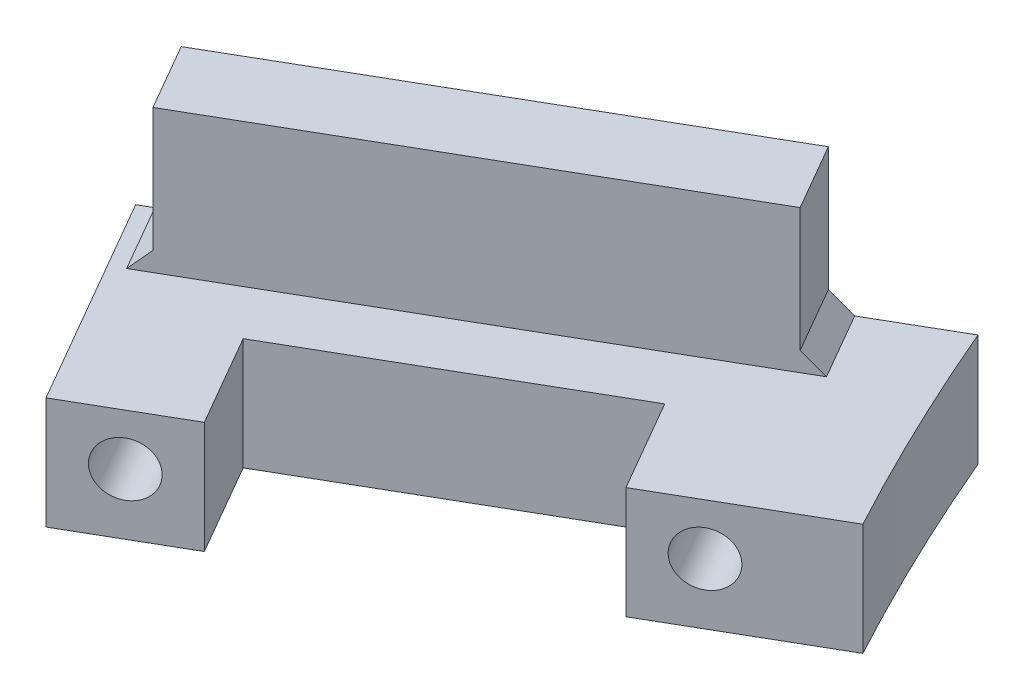
from build123d import *

# Parameters (mm, degrees)
SKETCH1_R             = 0.7
BOSS_EXTRUDE1_DEPTH   = 4.348
BOSS_EXTRUDE1_2_DEPTH = 4.348
SKETCH3_W             = 8
SKETCH3_H             = 2.9
BOSS_EXTRUDE2_DEPTH   = 1.598
BOSS_EXTRUDE3_DEPTH   = 2
MOVE_FACE1_BY         = 0.35
CHAMFER1_SIZE         = 0.5
BOSS_EXTRUDE4_DEPTH   = 2.9
MOVE_FACE2_DEPTH      = 2.9


# Read off the part's stored shape, not the designer's step: Move Face2
with BuildPart() as part:
    # Sketch1 → Boss-Extrude1 (new body)
    with BuildSketch(Plane(origin=(0, 0, 0), x_dir=(-0.8660254037844383, 0, 0.5000000000000009), z_dir=(-0.5000000000000008, 0, -0.8660254037844382))):
        Polygon((-11.354412945, 1.65), (-11.354412945, 2.9), (-16, 2.9), (-16, 0), (-11.354412945, 0), align=None)
        with Locations((-12.854412945, 1.575)):
            Circle(SKETCH1_R, mode=Mode.SUBTRACT)
    extrude(amount=BOSS_EXTRUDE1_DEPTH)



with BuildPart() as body_2:
    # Sketch1 → Boss-Extrude1 2 (new body)
    with BuildSketch(Plane(origin=(0, 0, 0), x_dir=(-0.8660254037844383, 0, 0.5000000000000009), z_dir=(-0.5000000000000008, 0, -0.8660254037844382))):
        Polygon((-3.354412945, 2.9), (-3.354412945, 1.65), (-3.354412945, 0), (0, 0), (0, 2.9), align=None)
        with Locations((-1.854412945, 1.575)):
            Circle(SKETCH1_R, mode=Mode.SUBTRACT)
    extrude(amount=BOSS_EXTRUDE1_2_DEPTH)


with BuildPart() as part_1:
    add(part.part)

    add(body_2.part)  # Boss-Extrude2 merges body 2
    # Sketch3 → Boss-Extrude2 (add)
    with BuildSketch(Plane(origin=(-2.174, 0, -3.765478456), x_dir=(-0.8660254037844384, 0, 0.5000000000000007), z_dir=(-0.5000000000000006, 0, -0.8660254037844383))):
        with Locations((-7.354412945, 1.45)):
            Rectangle(SKETCH3_W, SKETCH3_H)
    extrude(amount=-BOSS_EXTRUDE2_DEPTH)

    # Sketch4 → Boss-Extrude3 (add)
    with BuildSketch(Plane(origin=(-2.174, 0, -3.765478456), x_dir=(-0.8660254037844384, 0, 0.5000000000000007), z_dir=(-0.5000000000000006, 0, -0.8660254037844383))):
        Polygon((-1.214412945, 6.607188143), (-13.494412945, 6.607188143), (-13.494412945, 2.9), (-16, 2.9), (-16, 0), (0, 0), (0, 2.9), (-1.214412945, 2.9), align=None)
    extrude(amount=BOSS_EXTRUDE3_DEPTH)

    # Move Face1: a face moved inward by 0.35
    extrude(part_1.faces().sort_by_distance((-1.587, 1.45, -2.748764632))[0], amount=MOVE_FACE1_BY, dir=(0.866025404, 0, -0.5), mode=Mode.SUBTRACT)

    # Chamfer1
    chamfer1_edges = [part_1.edges().sort_by_distance(p)[0] for p in [
        (-1.622287539, 2.9, -5.238710332),
        (9.01250442, 2.9, -11.378710332),
    ]]
    chamfer(chamfer1_edges, length=CHAMFER1_SIZE)

    # Sketch5 → Boss-Extrude4 (add)
    with BuildSketch(Plane.XZ):
        with BuildLine():
            ThreePointArc((13.856406461, -8), (12.412098979, -10.837697405), (11.10213411, -13.739859135))
            Line((11.10213411, -13.739859135), (10.682406461, -13.497529263))
            Line((10.682406461, -13.497529263), (13.856406461, -8))
        make_face()
    extrude(amount=-BOSS_EXTRUDE4_DEPTH)

    # Move Face2 outline → Move Face2 (cut)
    with BuildSketch(Plane(origin=(0, 0, 0), x_dir=(1, 0, 0), z_dir=(0, 1, 0))):
        with BuildLine():
            ThreePointArc((10.97124357, 13.664289446), (12.281828843, 10.762456911), (13.726446616, 7.924967649))
            Line((13.726446616, 7.924967649), (13.856406461, 8))
            ThreePointArc((13.856406461, 8), (12.412098979, 10.837697405), (11.10213411, 13.739859135))
            Line((11.10213411, 13.739859135), (10.97124357, 13.664289446))
        make_face()
    extrude(amount=MOVE_FACE2_DEPTH, mode=Mode.SUBTRACT)


solid = part_1.part
